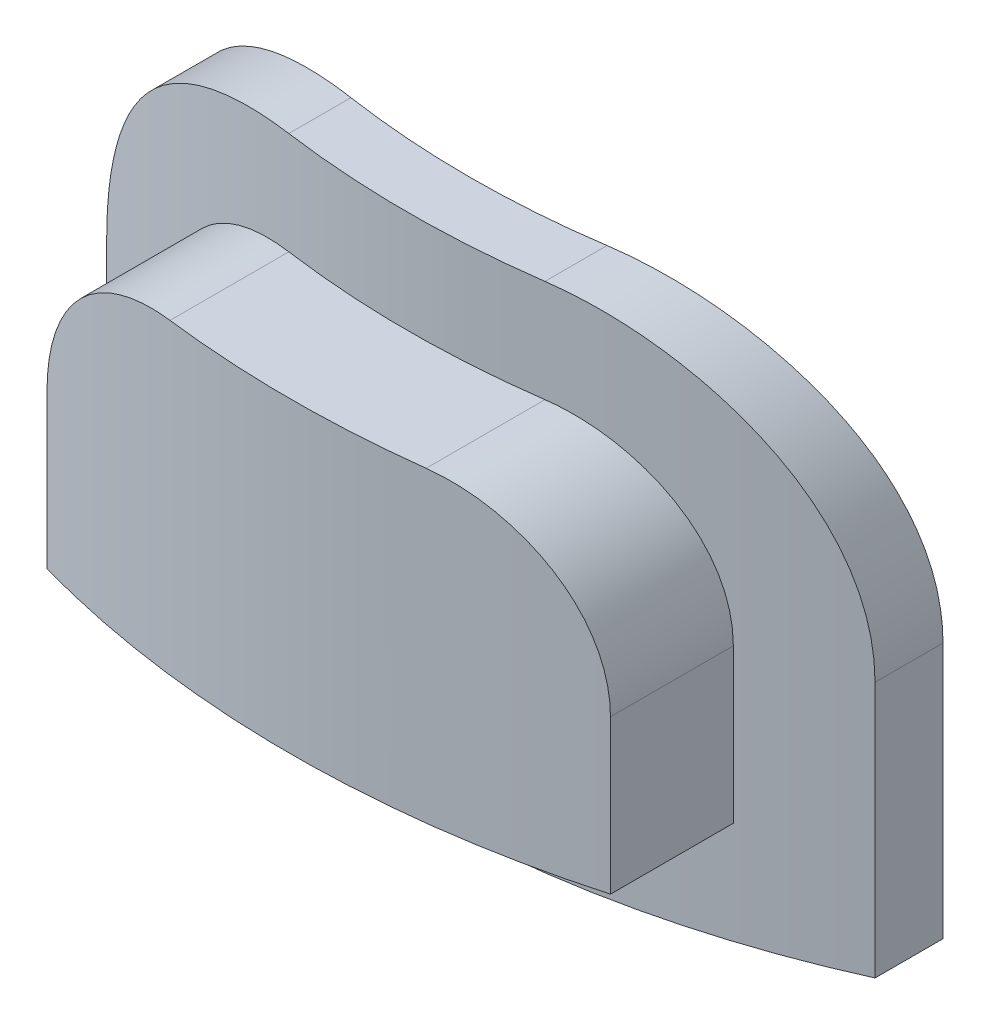
from build123d import *

# Parameters (mm, degrees)
SKETCH1_R               = 10.25
SKETCH1_R_2             = 8.5
BOSS_EXTRUDE1_DEPTH     = 5
CUT_EXTRUDE1_START      = -10.2500001
CUT_EXTRUDE1_OUTLINE_W  = 20.5
CUT_EXTRUDE1_OUTLINE_H  = 5
CUT_EXTRUDE1_DEPTH      = 17.878072963
CUT_EXTRUDE1_START_2    = 7.628072863
CUT_EXTRUDE1_2_DEPTH    = 2.545422212
CUT_EXTRUDE7_REACH      = 26.005
CUT_EXTRUDE7_END_RADIUS = 9.1
CUT_EXTRUDE7_START      = 12
SKETCH3_W               = 3
SKETCH3_H               = 1.8
CUT_EXTRUDE8_DEPTH      = 8.8


# Read off the part's stored shape, not the designer's step: Cut-Extrude1
with BuildPart() as part:
    # Sketch1 → Boss-Extrude1 (new body)
    with BuildSketch(Plane(origin=(0, 0, 0), x_dir=(1, 0, 0), z_dir=(0, 1, 0))):
        with Locations(Location((0, 0, 0), (0, 0, 270))):
            Circle(SKETCH1_R)
        with Locations(Location((0, 0, 0), (0, 0, 270))):
            Circle(SKETCH1_R_2, mode=Mode.SUBTRACT)
    extrude(amount=BOSS_EXTRUDE1_DEPTH)

    # Cut-Extrude1 outline → Cut-Extrude1 (cut)
    with BuildSketch(Plane.XY.offset(CUT_EXTRUDE1_START)):
        with Locations((0, 2.5)):
            Rectangle(CUT_EXTRUDE1_OUTLINE_W, CUT_EXTRUDE1_OUTLINE_H)
    extrude(amount=CUT_EXTRUDE1_DEPTH, mode=Mode.SUBTRACT)

    # Cut-Extrude1 2 outline → Cut-Extrude1 2 (cut)
    with BuildSketch(Plane.XY.offset(CUT_EXTRUDE1_START_2)):
        with BuildLine():
            ThreePointArc((-3.75, 2.5), (-3.017766953, 4.267766953), (-1.25, 5))
            Line((-1.25, 5), (-10.25, 5))
            Line((-10.25, 5), (-10.25, 0))
            Line((-10.25, 0), (-3.75, 0))
            Line((-3.75, 0), (-3.75, 2.5))
        make_face()
        with BuildLine():
            Line((10.25, 5), (1.25, 5))
            ThreePointArc((1.25, 5), (3.017766953, 4.267766953), (3.75, 2.5))
            Line((3.75, 2.5), (3.75, 0))
            Line((3.75, 0), (10.25, 0))
            Line((10.25, 0), (10.25, 5))
        make_face()
    extrude(amount=CUT_EXTRUDE1_2_DEPTH, mode=Mode.SUBTRACT)

    # Cut-Extrude7: up to this cylinder (the profile starts outside it)
    cut_extrude7_end = Plane(origin=(0, 2.7341405, 0), z_dir=(0, -1, 0)) * Cylinder(CUT_EXTRUDE7_END_RADIUS, 75.561441, mode=Mode.PRIVATE)
    # Sketch2<4> → Cut-Extrude7 (cut, up to the surface)
    with BuildSketch(Plane.XY.offset(CUT_EXTRUDE7_START), mode=Mode.PRIVATE) as cut_extrude7_sk1:
        with BuildLine():
            Line((1.25, 5), (-1.25, 5))
            ThreePointArc((-1.25, 5), (-3.017766953, 4.267766953), (-3.75, 2.5))
            ThreePointArc((-3.75, 2.5), (-3.017766953, 0.732233047), (-1.25, 0))
            Line((-1.25, 0), (1.25, 0))
            ThreePointArc((1.25, 0), (3.017766953, 0.732233047), (3.75, 2.5))
            ThreePointArc((3.75, 2.5), (3.017766953, 4.267766953), (1.25, 5))
        make_face()
        with BuildLine():
            ThreePointArc((-2.75, 2.5), (-2.310660172, 3.560660172), (-1.25, 4))
            Line((-1.25, 4), (1.25, 4))
            ThreePointArc((1.25, 4), (2.310660172, 3.560660172), (2.75, 2.5))
            Line((2.75, 2.5), (2.75, 1))
            Line((2.75, 1), (1.25, 1))
            Line((1.25, 1), (-1.25, 1))
            Line((-1.25, 1), (-2.75, 1))
            Line((-2.75, 1), (-2.75, 2.5))
        make_face(mode=Mode.SUBTRACT)
    cut_extrude7_tool1 = extrude(cut_extrude7_sk1.sketch, amount=-CUT_EXTRUDE7_REACH, mode=Mode.PRIVATE) - cut_extrude7_end
    add(cut_extrude7_tool1.solids().sort_by_distance((0, 4.909861, 12))[0], mode=Mode.SUBTRACT)
    # Sketch2<4> → Cut-Extrude7 (cut, up to the surface)
    with BuildSketch(Plane.XY.offset(CUT_EXTRUDE7_START), mode=Mode.PRIVATE) as cut_extrude7_sk2:
        with BuildLine():
            ThreePointArc((-1.25, 0), (-3.017766953, 0.732233047), (-3.75, 2.5))
            Line((-3.75, 2.5), (-3.75, 0))
            Line((-3.75, 0), (-1.25, 0))
        make_face()
    cut_extrude7_tool2 = extrude(cut_extrude7_sk2.sketch, amount=-CUT_EXTRUDE7_REACH, mode=Mode.PRIVATE) - cut_extrude7_end
    add(cut_extrude7_tool2.solids().sort_by_distance((-3.19158, 0.55842, 12))[0], mode=Mode.SUBTRACT)
    # Sketch2<4> → Cut-Extrude7 (cut, up to the surface)
    with BuildSketch(Plane.XY.offset(CUT_EXTRUDE7_START), mode=Mode.PRIVATE) as cut_extrude7_sk3:
        with BuildLine():
            Line((3.75, 0), (3.75, 2.5))
            ThreePointArc((3.75, 2.5), (3.017766953, 0.732233047), (1.25, 0))
            Line((1.25, 0), (3.75, 0))
        make_face()
    cut_extrude7_tool3 = extrude(cut_extrude7_sk3.sketch, amount=-CUT_EXTRUDE7_REACH, mode=Mode.PRIVATE) - cut_extrude7_end
    add(cut_extrude7_tool3.solids().sort_by_distance((3.19158, 0.55842, 12))[0], mode=Mode.SUBTRACT)

    # Sketch3 → Cut-Extrude8 (cut)
    with BuildSketch(Plane.XY):
        with Locations((0, 2.4)):
            Rectangle(SKETCH3_W, SKETCH3_H)
    extrude(amount=CUT_EXTRUDE8_DEPTH, mode=Mode.SUBTRACT)


solid = part.part
